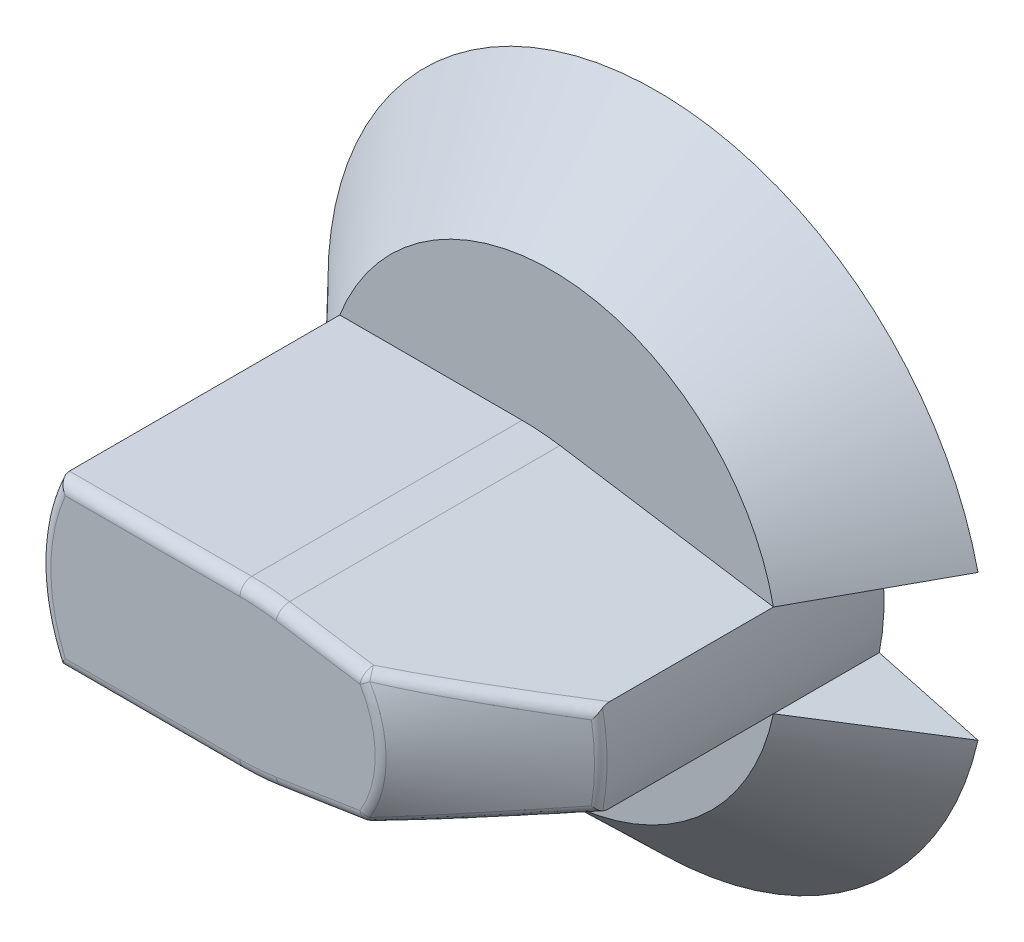
from build123d import *

# Parameters (mm, degrees)
SZKIC1_R                    = 14
DODANIE_WYCI_GNI_CIE1_DEPTH = 4.5
SFAZOWANIE2_SIZE2           = 4.345599487
SFAZOWANIE2_SIZE            = 4.5
DODANIE_WYCI_GNI_CIE5_DEPTH = 12
WYTNIJ_WYCI_GNI_CIE2_DEPTH  = 8
SFAZOWANIE4_SIZE            = 4.5
SFAZOWANIE4_SIZE2           = 4.95
ZAOKR_GLENIE2_R             = 0.5
ZAOKR_GLENIE3_R             = 10.5
WYTNIJ_WYCI_GNI_CIE3_DEPTH  = 6


# Some blends are built 0.0001 mm under size
with BuildPart() as part:
    # Szkic1 → Dodanie-wyciągnięcie1 (new body)
    with BuildSketch(Plane.XY):
        Circle(SZKIC1_R)
    extrude(amount=DODANIE_WYCI_GNI_CIE1_DEPTH)

    # Sfazowanie2
    sfazowanie2_edges = [part.edges().sort_by_distance(p)[0] for p in [
        (-14, 0, 4.5),
    ]]
    sfazowanie2_side = [part.faces().sort_by_distance(p)[0] for p in [
        (-14, 0, 4.41308801),
    ]]
    chamfer(sfazowanie2_edges, length=SFAZOWANIE2_SIZE - 0.0001, length2=SFAZOWANIE2_SIZE2 - 0.0001, reference=sfazowanie2_side[0])  # a hair under: the kernel refuses the full size

    # Szkic2 → Dodanie-wyciągnięcie5 (add)
    with BuildSketch(Plane.XY.offset(4.5)):
        with BuildLine():
            Line((9.452124483, 1.965907434), (-0.429502914, 3.5))
            Line((-0.429502914, 3.5), (-8.99763576, 3.5))
            ThreePointArc((-8.99763576, 3.5), (-9.786966842, 0), (-8.99763576, -3.5))
            Line((-8.99763576, -3.5), (-0.429502914, -3.5))
            Line((-0.429502914, -3.5), (9.452124483, -1.965907434))
            ThreePointArc((9.452124483, -1.965907434), (9.654400513, 0), (9.452124483, 1.965907434))
        make_face()
    extrude(amount=DODANIE_WYCI_GNI_CIE5_DEPTH)

    # Szkic8 → Wytnij-wyciągnięcie2 (cut)
    with BuildSketch(Plane(origin=(0, 0, 0), x_dir=(-1, 0, 0), z_dir=(0, 0, -1))):
        with BuildLine():
            Line((-9.452124483, 1.965907434), (-13.654313406, 3.091880562))
            ThreePointArc((-13.654313406, 3.091880562), (-14.042737349, 0), (-13.654313406, -3.091880562))
            Line((-13.654313406, -3.091880562), (-9.452124483, -1.965907434))
            ThreePointArc((-9.452124483, -1.965907434), (-9.654400513, 0), (-9.452124483, 1.965907434))
        make_face()
    extrude(amount=-WYTNIJ_WYCI_GNI_CIE2_DEPTH, mode=Mode.SUBTRACT)

    # Sfazowanie4
    sfazowanie4_edges = [part.edges().sort_by_distance(p)[0] for p in [
        (9.654400513, 0, 16.5),
    ]]
    sfazowanie4_side = [part.faces().sort_by_distance(p)[0] for p in [
        (9.654400513, 0, 8.25),
    ]]
    chamfer(sfazowanie4_edges, length=SFAZOWANIE4_SIZE, length2=SFAZOWANIE4_SIZE2, reference=sfazowanie4_side[0])

    # Zaokrąglenie2
    zaokr_glenie2_edges = [part.edges().sort_by_distance(p)[0] for p in [
        (-9.786966842, 0, 16.5),
        (-4.713569337, -3.5, 16.5),
        (1.655695985, -3.17627922, 16.5),
        (-4.713569337, 3.5, 16.5),
        (1.655695985, 3.17627922, 16.5),
        (4.704400513, 0, 16.5),
        (6.663505686, 2.398832011, 14.338418901),
        (9.654400513, 0, 12),
        (6.663505686, -2.398832011, 14.338418901),
    ]]
    fillet(zaokr_glenie2_edges, radius=ZAOKR_GLENIE2_R)

    # Zaokrąglenie3
    # the kernel refuses this fillet: 10.5 mm, written as the material it takes off along each edge
    with BuildSketch(Plane(origin=(-1.239696749, -7, 16.5), x_dir=(0.15340925660527832, 0.9881627396273429, 0), z_dir=(0.9881627396273429, -0.15340925660527832, 0))) as zaokr_glenie3_piece_1:
        with BuildLine():
            CenterArc((10, -0.5), 0.5, 0, 90)
            Line((10.5, -0.5), (10.5, 0))
            Line((10.5, 0), (10, 0))
        make_face()
    revolve(axis=Axis((-1.239696749, -7, 16.5), (0, 0, 1)), revolution_arc=8.824549996, mode=Mode.SUBTRACT)
    with BuildSketch(Plane(origin=(-1.239696749, 7, 16.5), x_dir=(0, -1, 0), z_dir=(-1, 0, 0))) as zaokr_glenie3_piece_2:
        with BuildLine():
            CenterArc((10, -0.5), 0.5, 0, 90)
            Line((10.5, -0.5), (10.5, 0))
            Line((10.5, 0), (10, 0))
        make_face()
    revolve(axis=Axis((-1.239696749, 7, 16.5), (0, 0, 1)), revolution_arc=8.824549996, mode=Mode.SUBTRACT)
    with BuildSketch(Plane(origin=(-0.429502914, -3.5, 4.5), x_dir=(0.9881627396273429, 0.15340925660527846, 0), z_dir=(0, 0, 1))) as zaokr_glenie3_piece_3:
        with BuildLine():
            CenterArc((ZAOKR_GLENIE3_R * 0.0771613176062, ZAOKR_GLENIE3_R), ZAOKR_GLENIE3_R, 261.175450004, 8.824549996)
            Line((-ZAOKR_GLENIE3_R * 0.076247938999, ZAOKR_GLENIE3_R * 0.0118372603727), (0, 0))
            Line((0, 0), (ZAOKR_GLENIE3_R * 0.0771613176062, 0))
        make_face()
    extrude(amount=12, mode=Mode.SUBTRACT)
    with BuildSketch(Plane(origin=(-0.429502914, 3.5, 4.5), x_dir=(0.9881627396273429, -0.15340925660527815, 0), z_dir=(0, 0, 1))) as zaokr_glenie3_piece_4:
        with BuildLine():
            CenterArc((ZAOKR_GLENIE3_R * 0.0771613176062, -ZAOKR_GLENIE3_R), ZAOKR_GLENIE3_R, 90, 8.824549996)
            Line((-ZAOKR_GLENIE3_R * 0.076247938999, -ZAOKR_GLENIE3_R * 0.0118372603727), (0, 0))
            Line((0, 0), (ZAOKR_GLENIE3_R * 0.0771613176062, 0))
        make_face()
    extrude(amount=12, mode=Mode.SUBTRACT)

    # Szkic9 → Wytnij-wyciągnięcie3 (cut)
    with BuildSketch(Plane(origin=(0, 0, 0), x_dir=(-1, 0, 0), z_dir=(0, 0, -1))):
        with BuildLine():
            Line((1.17, -1.149217125), (-1.17, -1.149217125))
            ThreePointArc((-1.17, -1.149217125), (0, 1.64), (1.17, -1.149217125))
        make_face()
    extrude(amount=-WYTNIJ_WYCI_GNI_CIE3_DEPTH, mode=Mode.SUBTRACT)


solid = part.part
